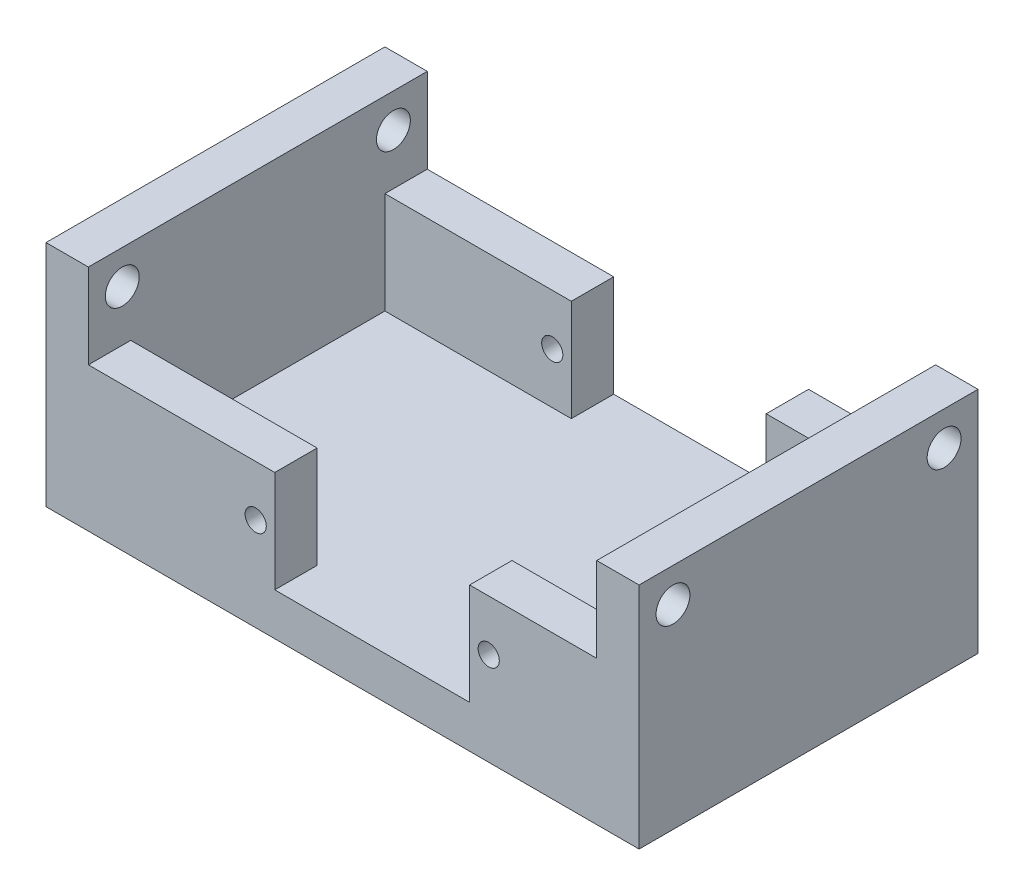
from build123d import *

# Parameters (mm, degrees)
SKETCH1_W               = 70
SKETCH1_H               = 40
BOSS_EXTRUDE1_DEPTH     = 5
BOSS_EXTRUDE2_DEPTH     = 12
SKETCH3_W               = 5
SKETCH3_H               = 40
BOSS_EXTRUDE3_DEPTH     = 10
SKETCH5_R               = 2
CUT_EXTRUDE1_DEPTH      = 78.646635471
CUT_EXTRUDE2_DEPTH      = 57.382621436
CUT_EXTRUDE2_DEPTH_BACK = 57.382621436
SKETCH6_R               = 1.25


with BuildPart() as part:
    # Sketch1 → Boss-Extrude1 (new body)
    with BuildSketch(Plane(origin=(0, 0, 0), x_dir=(1, 0, 0), z_dir=(0, 1, 0))):
        Rectangle(SKETCH1_W, SKETCH1_H)
    extrude(amount=BOSS_EXTRUDE1_DEPTH)

    # Sketch2 → Boss-Extrude2 (add)
    with BuildSketch(Plane(origin=(0, 5, 0), x_dir=(1, 0, 0), z_dir=(0, 1, 0))):
        Polygon((-8, -20), (-8, -15), (-30, -15), (-30, 15), (-8, 15), (-8, 20), (-35, 20), (-35, -20), align=None)
        Polygon((15, -15), (30, -15), (30, 15), (15, 15), (15, 20), (35, 20), (35, -20), (15, -20), align=None)
    extrude(amount=BOSS_EXTRUDE2_DEPTH)

    # Sketch3 → Boss-Extrude3 (add)
    with BuildSketch(Plane(origin=(0, 17, 0), x_dir=(1, 0, 0), z_dir=(0, 1, 0))):
        with Locations((32.5, 0)):
            Rectangle(SKETCH3_W, SKETCH3_H)
        with Locations((-32.5, 0)):
            Rectangle(SKETCH3_W, SKETCH3_H)
    extrude(amount=BOSS_EXTRUDE3_DEPTH)

    # Sketch5 → Cut-Extrude1 (cut, through all)
    with BuildSketch(Plane.ZY.offset(35)):
        with Locations((16, 23)):
            Circle(SKETCH5_R)
        with Locations((-16, 23)):
            Circle(SKETCH5_R)
    extrude(amount=-CUT_EXTRUDE1_DEPTH, mode=Mode.SUBTRACT)

    # Sketch6 → Cut-Extrude2 (cut, two sides: drawn at the far end of the back side and taken through both)
    with BuildSketch(Plane(origin=(0, 0, 15), x_dir=(-1, 0, 0), z_dir=(0, 0, -1)).offset(-CUT_EXTRUDE2_DEPTH_BACK)):
        with Locations((10.25, 11)):
            Circle(SKETCH6_R)
        with Locations((-17.25, 11)):
            Circle(SKETCH6_R)
    extrude(amount=CUT_EXTRUDE2_DEPTH + CUT_EXTRUDE2_DEPTH_BACK, mode=Mode.SUBTRACT)


solid = part.part
